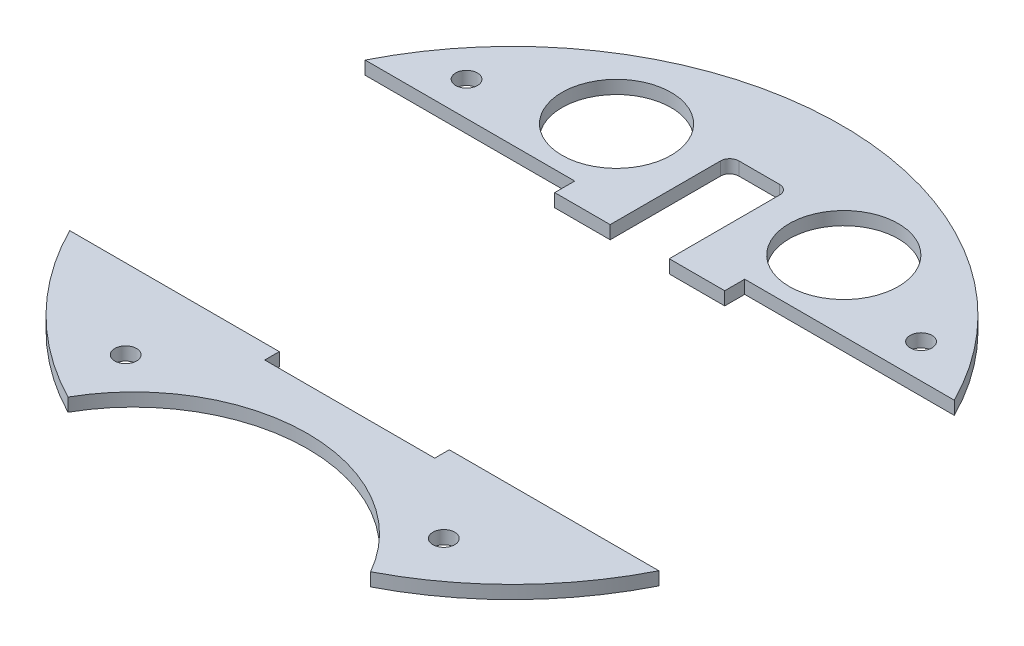
from build123d import *

# Parameters (mm, degrees)
BOSS_EXTRUDE1_DEPTH  = 2.9
SOLENOID_PLACEMENT_W = 37.4
SOLENOID_PLACEMENT_H = 63.8
CUT_EXTRUDE1_DEPTH   = 103.571487266
CUT_EXTRUDE4_DEPTH   = 103.571487266
SKETCH5_R            = 12
CUT_EXTRUDE5_DEPTH   = 103.571487266
SKETCH6_R            = 2.4
CUT_EXTRUDE6_DEPTH   = 103.571487266
CUT_EXTRUDE3_DEPTH   = 103.571487266


with BuildPart() as part:
    # Sketch1 → Boss-Extrude1 (new body)
    with BuildSketch(Plane(origin=(0, 0, 0), x_dir=(1, 0, 0), z_dir=(0, 1, 0))):
        with BuildLine():
            ThreePointArc((33.29110537, -64.404598464), (0, 72.5), (-33.29110537, -64.404598464))
            ThreePointArc((-33.29110537, -64.404598464), (0, -44.989799638), (33.29110537, -64.404598464))
        make_face()
    extrude(amount=BOSS_EXTRUDE1_DEPTH)

    # solenoid placement → Cut-Extrude1 (cut, through all)
    with BuildSketch(Plane(origin=(0, 2.9, 0), x_dir=(1, 0, 0), z_dir=(0, 1, 0))):
        with Locations((0, -3.8)):
            Rectangle(SOLENOID_PLACEMENT_W, SOLENOID_PLACEMENT_H)
    extrude(amount=-CUT_EXTRUDE1_DEPTH, mode=Mode.SUBTRACT)

    # Sketch4 → Cut-Extrude4 (cut, through all)
    with BuildSketch(Plane(origin=(0, 2.9, 0), x_dir=(1, 0, 0), z_dir=(0, 1, 0))):
        with BuildLine():
            Line((-6.5, 28.1), (6.5, 28.1))
            Line((6.5, 28.1), (6.5, 52.4))
            ThreePointArc((6.5, 52.4), (5.914213562, 53.814213562), (4.5, 54.4))
            Line((4.5, 54.4), (-4.5, 54.4))
            ThreePointArc((-4.5, 54.4), (-5.914213562, 53.814213562), (-6.5, 52.4))
            Line((-6.5, 52.4), (-6.5, 28.1))
        make_face()
    extrude(amount=-CUT_EXTRUDE4_DEPTH, mode=Mode.SUBTRACT)

    # Sketch5 → Cut-Extrude5 (cut, through all)
    with BuildSketch(Plane(origin=(0, 2.9, 0), x_dir=(1, 0, 0), z_dir=(0, 1, 0))):
        with Locations((-25, 48)):
            Circle(SKETCH5_R)
        with Locations((25, 48)):
            Circle(SKETCH5_R)
    extrude(amount=-CUT_EXTRUDE5_DEPTH, mode=Mode.SUBTRACT)

    # Sketch6 → Cut-Extrude6 (cut, through all)
    with BuildSketch(Plane(origin=(0, 2.9, 0), x_dir=(1, 0, 0), z_dir=(0, 1, 0))):
        with Locations((35, -50)):
            Circle(SKETCH6_R)
        with Locations((-35, -50)):
            Circle(SKETCH6_R)
        with Locations((-50, 40)):
            Circle(SKETCH6_R)
        with Locations((50, 40)):
            Circle(SKETCH6_R)
    extrude(amount=-CUT_EXTRUDE6_DEPTH, mode=Mode.SUBTRACT)

    # Sketch3 → Cut-Extrude3 (cut, through all)
    with BuildSketch(Plane(origin=(0, 2.9, 0), x_dir=(1, 0, 0), z_dir=(0, 1, 0))):
        Polygon((-18.7, 28.1), (18.7, 28.1), (18.7, 32.5), (72.5, 32.5), (72.5, -32.5), (-72.5, -32.5), (-72.5, 32.5), (-18.7, 32.5), align=None)
    extrude(amount=-CUT_EXTRUDE3_DEPTH, mode=Mode.SUBTRACT)


with BuildPart() as cut_extrude3_piece_1:
    # of the separate pieces the step leaves, piece 1, a body of its own (cut_extrude3_pieces)
    add(part.part.solids().sort_by_distance((64.807406984, 0, -32.5))[0])


with BuildPart() as cut_extrude3_piece_2:
    # of the separate pieces the step leaves, piece 2, a body of its own (cut_extrude3_pieces)
    add(part.part.solids().sort_by_distance((-33.29110537, 0, 64.404598464))[0])


solid = Compound([cut_extrude3_piece_1.part, cut_extrude3_piece_2.part])
